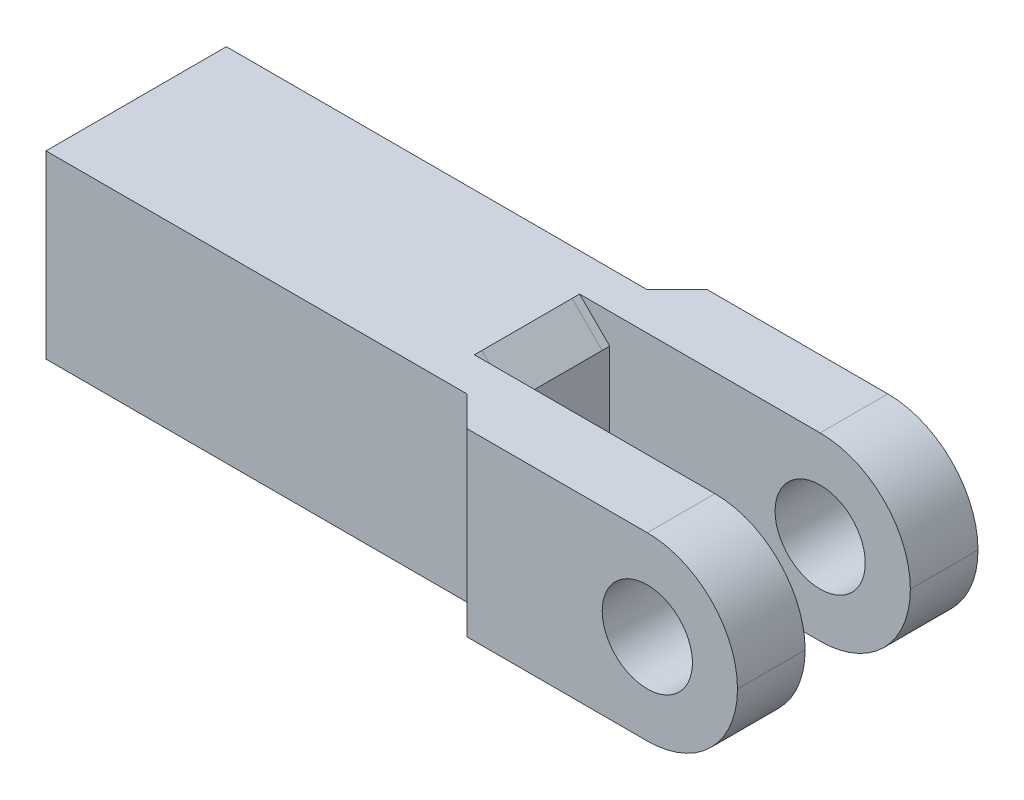
from build123d import *

# Parameters (mm, degrees)
SKETCH1_W                = 6
SKETCH1_H                = 6
BOSS_EXTRUDE1_DEPTH      = 14
SKETCH2_W                = 1
SKETCH2_H                = 6
SKETCH2_W_2              = 1.5
BOSS_EXTRUDE2_DEPTH      = 10
FILLET1_R                = 3
SKETCH3_R                = 1.5
CUT_EXTRUDE1_DEPTH       = 10
CHAMFER1_SIZE            = 1
CHAMFER2_SIZE            = 1
FILLET1_OF_MIRROR2_R     = 3
CHAMFER1_OF_MIRROR2_SIZE = 1
SKETCH4_R                = 1.25
CUT_EXTRUDE2_DEPTH       = 13
CHAMFER3_SIZE            = 1
CUT_EXTRUDE3_DEPTH       = 10
CUT_EXTRUDE3_DEPTH_BACK  = 10
SKETCH5_W                = 10
SKETCH5_H                = 0.25
CUT_EXTRUDE4_DEPTH       = 10
CUT_EXTRUDE4_DEPTH_BACK  = 10
SKETCH6_W                = 10
SKETCH6_H                = 0.25
CHAMFER4_SIZE            = 1


with BuildPart() as part:
    # Sketch1 → Boss-Extrude1 (new body)
    with BuildSketch(Plane(origin=(0, 0, 0), x_dir=(0, 0, -1), z_dir=(1, 0, 0))):
        Rectangle(SKETCH1_W, SKETCH1_H)
    boss_extrude1 = extrude(amount=BOSS_EXTRUDE1_DEPTH)

    # Sketch2 → Boss-Extrude2 (add)
    with BuildSketch(Plane(origin=(14, 0, 0), x_dir=(0, 0, -1), z_dir=(1, 0, 0))):
        with Locations((3.5, 0)):
            Rectangle(SKETCH2_W, SKETCH2_H)
        with Locations((2.25, 0)):
            Rectangle(SKETCH2_W_2, SKETCH2_H)
    boss_extrude2 = extrude(amount=BOSS_EXTRUDE2_DEPTH)

    # Fillet1
    fillet1_edges = [part.edges().sort_by_distance(p)[0] for p in [
        (24, 3, -2.75),
        (24, -3, -2.75),
    ]]
    fillet(fillet1_edges, radius=FILLET1_R - 0.0001)  # a hair under: the kernel refuses the full size

    # Sketch3 → Cut-Extrude1 (cut)
    with BuildSketch(Plane(origin=(0, 0, -4), x_dir=(-1, 0, 0), z_dir=(0, 0, -1))):
        with Locations((-21, 0)):
            Circle(SKETCH3_R)
    cut_extrude1 = extrude(amount=-CUT_EXTRUDE1_DEPTH, mode=Mode.SUBTRACT)

    # Chamfer1
    chamfer1_edges = [part.edges().sort_by_distance(p)[0] for p in [
        (14, 0, -4),
    ]]
    chamfer(chamfer1_edges, length=CHAMFER1_SIZE - 0.0001)  # a hair under: the kernel refuses the full size

    # Chamfer2
    chamfer2_edges = [part.edges().sort_by_distance(p)[0] for p in [
        (14, 3, 0.75),
        (14, -3, 0.75),
    ]]
    chamfer(chamfer2_edges, length=CHAMFER2_SIZE)

    # Mirror2: Boss-Extrude1, Boss-Extrude2, Cut-Extrude1 across plane
    add(boss_extrude1.mirror(Plane(origin=(0, 0, 0), x_dir=(1, 0, 0), z_dir=(0, 0, -1))))
    add(boss_extrude2.mirror(Plane(origin=(0, 0, 0), x_dir=(1, 0, 0), z_dir=(0, 0, -1))))
    add(cut_extrude1.mirror(Plane(origin=(0, 0, 0), x_dir=(1, 0, 0), z_dir=(0, 0, -1))), mode=Mode.SUBTRACT)

    # Fillet1 of Mirror2
    fillet1_of_mirror2_edges = [part.edges().sort_by_distance(p)[0] for p in [
        (24, 3, 2.75),
        (24, -3, 2.75),
    ]]
    fillet(fillet1_of_mirror2_edges, radius=FILLET1_OF_MIRROR2_R - 0.0001)  # a hair under: the kernel refuses the full size

    # Chamfer1 of Mirror2
    chamfer1_of_mirror2_edges = [part.edges().sort_by_distance(p)[0] for p in [
        (14, 0, 4),
    ]]
    chamfer(chamfer1_of_mirror2_edges, length=CHAMFER1_OF_MIRROR2_SIZE - 0.0001)  # a hair under: the kernel refuses the full size

    # Sketch4 → Cut-Extrude2 (cut)
    with BuildSketch(Plane.ZY):
        Circle(SKETCH4_R)
    extrude(amount=-CUT_EXTRUDE2_DEPTH, mode=Mode.SUBTRACT)

    # Chamfer3
    chamfer3_edges = [part.edges().sort_by_distance(p)[0] for p in [
        (14, -3, 0),
        (14, 3, 0),
    ]]
    chamfer(chamfer3_edges, length=CHAMFER3_SIZE)

    # Sketch5 → Cut-Extrude3 (cut, two sides: drawn at the far end of the back side and taken through both)
    with BuildSketch(Plane(origin=(0, 0, 0), x_dir=(1, 0, 0), z_dir=(0, 1, 0)).offset(-CUT_EXTRUDE3_DEPTH_BACK)):
        with Locations((19, -1.625)):
            Rectangle(SKETCH5_W, SKETCH5_H)
    extrude(amount=CUT_EXTRUDE3_DEPTH + CUT_EXTRUDE3_DEPTH_BACK, mode=Mode.SUBTRACT)

    # Sketch6 → Cut-Extrude4 (cut, two sides: drawn at the far end of the back side and taken through both)
    with BuildSketch(Plane(origin=(0, 0, 0), x_dir=(1, 0, 0), z_dir=(0, 1, 0)).offset(-CUT_EXTRUDE4_DEPTH_BACK)):
        with Locations((19, 1.625)):
            Rectangle(SKETCH6_W, SKETCH6_H)
    extrude(amount=CUT_EXTRUDE4_DEPTH + CUT_EXTRUDE4_DEPTH_BACK, mode=Mode.SUBTRACT)

    # Chamfer4
    chamfer4_edges = [part.edges().sort_by_distance(p)[0] for p in [
        (14, -3, 1.625),
        (14, -3, -1.625),
        (14, 3, -1.625),
        (14, 3, 1.625),
    ]]
    chamfer(chamfer4_edges, length=CHAMFER4_SIZE - 0.0001)  # a hair under: the kernel refuses the full size


solid = part.part
